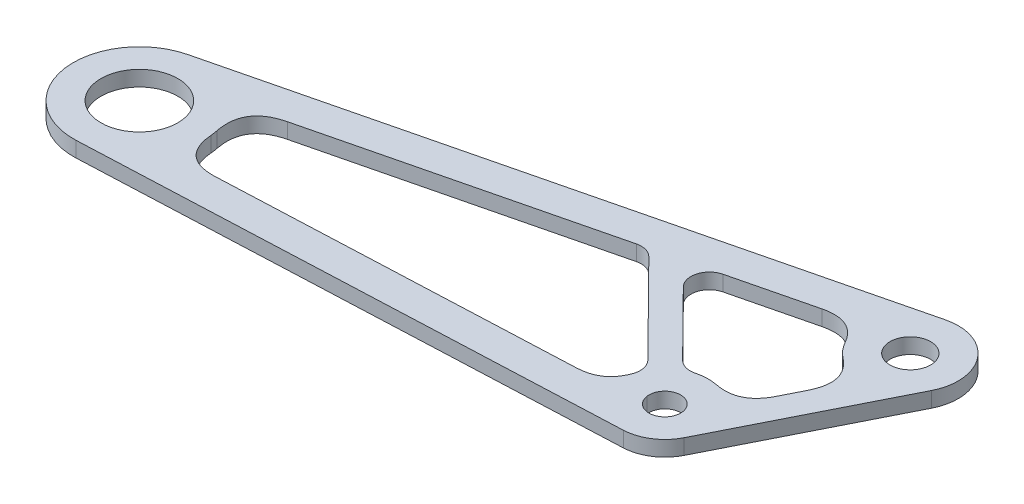
from build123d import *

# Parameters (mm, degrees)
BOSS_EXTRUDE4_DEPTH = 3.175
FILLET2_R           = 3.81


with BuildPart() as part:
    # Sketch1 → Boss-Extrude4 (new body)
    with BuildSketch(Plane(origin=(0, 0, 0), x_dir=(1, 0, 0), z_dir=(0, 1, 0))):
        with BuildLine():
            ThreePointArc((134.783763158, 34.440613651), (130.992755953, 42.233924829), (122.521356715, 44.06226552))
            ThreePointArc((122.521356715, 44.06226552), (117.722413764, 41.291147284), (115.162703171, 36.376187325))
            Line((115.162703171, 36.376187325), (123.88082197, 38.511312519))
            ThreePointArc((123.88082197, 38.511312519), (127.464875494, 37.737783765), (129.068763158, 34.440613651))
            ThreePointArc((129.068763158, 34.440613651), (128.955414212, 33.4725006), (128.621498601, 32.556754332))
            Line((128.621498601, 32.556754332), (124.58688197, 24.538885311))
            ThreePointArc((124.58688197, 24.538885311), (129.950478116, 25.932006306), (133.726592386, 29.98785526))
            ThreePointArc((133.726592386, 29.98785526), (134.515847468, 32.152346439), (134.783763158, 34.440613651))
        make_face()
        with BuildLine():
            Line((123.88082197, 38.511312519), (115.162703171, 36.376187325))
            ThreePointArc((115.162703171, 36.376187325), (115.052676855, 35.70414645), (114.98908268, 35.026134276))
            ThreePointArc((114.98908268, 35.026134276), (117.127915131, 28.270630543), (123.232258698, 24.672238604))
            ThreePointArc((123.232258698, 24.672238604), (123.907277135, 24.582267295), (124.58688197, 24.538885311))
            Line((124.58688197, 24.538885311), (128.621498601, 32.556754332))
            ThreePointArc((128.621498601, 32.556754332), (121.5989813, 31.830236182), (123.88082197, 38.511312519))
        make_face()
        with BuildLine():
            Line((122.521356715, 44.06226552), (-3.247611444, 13.260609947))
            ThreePointArc((-3.247611444, 13.260609947), (3.178857668, 13.277259513), (8.900967118, 10.351982448))
            Line((8.900967118, 10.351982448), (70.354618788, 25.402389875))
            Line((70.354618788, 25.402389875), (78.030840873, 27.282347644))
            Line((78.030840873, 27.282347644), (83.782484894, 28.690963463))
            Line((83.782484894, 28.690963463), (115.162703171, 36.376187325))
            ThreePointArc((115.162703171, 36.376187325), (117.722413764, 41.291147284), (122.521356715, 44.06226552))
        make_face()
        with BuildLine():
            ThreePointArc((8.900967118, 10.351982448), (3.178857668, 13.277259513), (-3.247611444, 13.260609947))
            ThreePointArc((-3.247611444, 13.260609947), (-13.515826194, -1.926966151), (0.587616374, -13.639848359))
            ThreePointArc((0.587616374, -13.639848359), (3.65523919, -13.15408616), (6.533692532, -11.987560976))
            ThreePointArc((6.533692532, -11.987560976), (9.268219921, -10.024512744), (11.439307143, -7.452047258))
            Line((11.439307143, -7.452047258), (0.341637427, -7.930144395))
            ThreePointArc((0.341637427, -7.930144395), (-7.858038485, -1.120329158), (-1.888146188, 7.709656946))
            Line((-1.888146188, 7.709656946), (8.900967118, 10.351982448))
        make_face()
        with BuildLine():
            ThreePointArc((9.985636063, 9.310092839), (9.457659775, 9.845985366), (8.900967118, 10.351982448))
            Line((8.900967118, 10.351982448), (-1.888146188, 7.709656946))
            ThreePointArc((-1.888146188, 7.709656946), (4.899833971, 6.244640367), (7.9375, 0))
            ThreePointArc((7.9375, 0), (5.732174689, -5.490544562), (0.341637427, -7.930144395))
            Line((0.341637427, -7.930144395), (11.439307143, -7.452047258))
            ThreePointArc((11.439307143, -7.452047258), (11.832412595, -6.810636419), (12.189591197, -6.148546389))
            ThreePointArc((12.189591197, -6.148546389), (13.281738404, -3.160091963), (13.6525, 0))
            ThreePointArc((13.6525, 0), (12.702748769, 5.003092039), (9.985636063, 9.310092839))
        make_face()
        with BuildLine():
            Line((70.354618788, 25.402389875), (8.900967118, 10.351982448))
            ThreePointArc((8.900967118, 10.351982448), (9.457659775, 9.845985366), (9.985636063, 9.310092839))
            Line((9.985636063, 9.310092839), (69.18664036, 23.808811963))
            Line((69.18664036, 23.808811963), (70.354618788, 25.402389875))
        make_face()
        with BuildLine():
            ThreePointArc((12.189591197, -6.148546389), (11.832412595, -6.810636419), (11.439307143, -7.452047258))
            Line((11.439307143, -7.452047258), (47.410466333, -5.902378846))
            Line((47.410466333, -5.902378846), (48.372525925, -4.589754505))
            Line((48.372525925, -4.589754505), (12.189591197, -6.148546389))
        make_face()
        with BuildLine():
            ThreePointArc((6.533692532, -11.987560976), (3.65523919, -13.15408616), (0.587616374, -13.639848359))
            Line((0.587616374, -13.639848359), (108.971460257, -8.970579339))
            ThreePointArc((108.971460257, -8.970579339), (108.77827491, -8.976819594), (108.585, -8.9789))
            ThreePointArc((108.585, -8.9789), (103.680463266, -7.521048108), (100.368568874, -3.620898335))
            Line((100.368568874, -3.620898335), (53.914169694, -5.622193724))
            Line((53.914169694, -5.622193724), (47.410466333, -5.902378846))
            Line((47.410466333, -5.902378846), (11.439307143, -7.452047258))
            ThreePointArc((11.439307143, -7.452047258), (9.268219921, -10.024512744), (6.533692532, -11.987560976))
        make_face()
        with BuildLine():
            Line((53.914169694, -5.622193724), (100.368568874, -3.620898335))
            ThreePointArc((100.368568874, -3.620898335), (100.12320514, -3.003110548), (99.924218758, -2.368863331))
            Line((99.924218758, -2.368863331), (54.876229285, -4.309569382))
            Line((54.876229285, -4.309569382), (53.914169694, -5.622193724))
        make_face()
        Polygon((48.372525925, -4.589754505), (47.410466333, -5.902378846), (53.914169694, -5.622193724), (54.876229285, -4.309569382), align=None)
        with BuildLine():
            Line((104.335087932, 7.90941797), (84.823475635, 27.638376771))
            Line((84.823475635, 27.638376771), (79.071831614, 26.229760952))
            Line((79.071831614, 26.229760952), (100.723144875, 4.337266328))
            ThreePointArc((100.723144875, 4.337266328), (102.271221973, 6.384109354), (104.335087932, 7.90941797))
        make_face()
        Polygon((78.030840873, 27.282347644), (70.354618788, 25.402389875), (69.18664036, 23.808811963), (76.862862445, 25.688769732), align=None)
        Polygon((84.823475635, 27.638376771), (83.782484894, 28.690963463), (78.030840873, 27.282347644), (79.071831614, 26.229760952), align=None)
        with BuildLine():
            ThreePointArc((114.98908268, 35.026134276), (115.052676855, 35.70414645), (115.162703171, 36.376187325))
            Line((115.162703171, 36.376187325), (83.782484894, 28.690963463))
            Line((83.782484894, 28.690963463), (84.823475635, 27.638376771))
            Line((84.823475635, 27.638376771), (114.98908268, 35.026134276))
        make_face()
        Polygon((79.071831614, 26.229760952), (78.030840873, 27.282347644), (76.862862445, 25.688769732), align=None)
        with BuildLine():
            Line((116.60566957, -4.036025875), (133.726592386, 29.98785526))
            ThreePointArc((133.726592386, 29.98785526), (129.950478116, 25.932006306), (124.58688197, 24.538885311))
            Line((124.58688197, 24.538885311), (115.260501822, 6.004858086))
            ThreePointArc((115.260501822, 6.004858086), (116.968296145, 3.21574112), (117.5639, 0))
            ThreePointArc((117.5639, 0), (117.321058471, -2.07410887), (116.60566957, -4.036025875))
        make_face()
        with BuildLine():
            ThreePointArc((108.585, -8.9789), (108.77827491, -8.976819594), (108.971460257, -8.970579339))
            ThreePointArc((108.971460257, -8.970579339), (113.459157615, -7.540771363), (116.60566957, -4.036025875))
            ThreePointArc((116.60566957, -4.036025875), (117.321058471, -2.07410887), (117.5639, 0))
            ThreePointArc((117.5639, 0), (116.968296145, 3.21574112), (115.260501822, 6.004858086))
            Line((115.260501822, 6.004858086), (111.500575784, -1.467126803))
            ThreePointArc((111.500575784, -1.467126803), (110.356794211, -2.741129053), (108.72548131, -3.260875375))
            Line((108.72548131, -3.260875375), (100.368568874, -3.620898335))
            ThreePointArc((100.368568874, -3.620898335), (103.680463266, -7.521048108), (108.585, -8.9789))
        make_face()
        with BuildLine():
            ThreePointArc((99.924218758, -2.368863331), (100.12320514, -3.003110548), (100.368568874, -3.620898335))
            Line((100.368568874, -3.620898335), (108.72548131, -3.260875375))
            ThreePointArc((108.72548131, -3.260875375), (106.227929768, 2.257711924), (111.8489, 0))
            ThreePointArc((111.8489, 0), (111.760625215, -0.75395471), (111.500575784, -1.467126803))
            Line((111.500575784, -1.467126803), (115.260501822, 6.004858086))
            ThreePointArc((115.260501822, 6.004858086), (114.79795902, 6.482266998), (114.301364272, 6.924147942))
            ThreePointArc((114.301364272, 6.924147942), (109.468351444, 8.935341932), (104.335087932, 7.90941797))
            ThreePointArc((104.335087932, 7.90941797), (102.271221973, 6.384109354), (100.723144875, 4.337266328))
            ThreePointArc((100.723144875, 4.337266328), (99.66914772, 1.062178575), (99.924218758, -2.368863331))
        make_face()
    extrude(amount=-BOSS_EXTRUDE4_DEPTH)

    # Fillet1
    # a fillet whose section is not a circle: 7.62 mm, written as the material it adds along each edge
    with BuildSketch(Plane(origin=(115.260501822, 0, -6.004858086), x_dir=(-0.8680919950979774, 0, -0.49640335217120884), z_dir=(0, -1, 0))) as fillet1_piece_1:
        with BuildLine():
            Bezier((5.628236023, 0), (0.097286133, 1.825453133), (0.407253439, 7.641603586), weights=[1, 1, 1])
            Line((0.407253439, 7.641603586), (0, 0))
            ThreePointArc((0, 0), (2.814118011, 0.452389282), (5.628236023, 0))
        make_face()
    extrude(amount=3.175)
    with BuildSketch(Plane(origin=(124.58688197, 0, -24.538885311), x_dir=(-0.940652377409321, 0, -0.3393716323946247), z_dir=(0, -1, 0))) as fillet1_piece_2:
        with BuildLine():
            Bezier((6.173495259, 0), (0.234745196, -1.947499202), (0.982676409, -8.152505596), weights=[1, 1, 1])
            Line((0.982676409, -8.152505596), (0, 0))
            ThreePointArc((0, 0), (3.08674763, -0.493198872), (6.173495259, 0))
        make_face()
    extrude(amount=3.175)
    with BuildSketch(Plane(origin=(114.98908268, 0, -35.026134276), x_dir=(0.22431195725050157, 0, 0.9745173912426853), z_dir=(0, -1, 0))) as fillet1_piece_3:
        with BuildLine():
            Bezier((5.577498608, 0), (0.022723171, 1.629700449), (0.103430981, 7.418045632), weights=[1, 1, 1])
            Line((0.103430981, 7.418045632), (0, 0))
            ThreePointArc((0, 0), (2.788749304, 0.400648175), (5.577498608, 0))
        make_face()
    extrude(amount=3.175)
    with BuildSketch(Plane(origin=(9.985636063, 0, -9.310092839), x_dir=(0.9712953632492297, 0, -0.23787668513443458), z_dir=(0, -1, 0))) as fillet1_piece_4:
        with BuildLine():
            Bezier((9.337508644, 0), (2.051395042, 0), (1.725151149, 7.27880597), weights=[1, 1, 1])
            ThreePointArc((1.725151149, 7.27880597), (1.370821683, 3.518943481), (0, 0))
            Line((0, 0), (9.337508644, 0))
        make_face()
    extrude(amount=3.175)
    with BuildSketch(Plane(origin=(99.924218758, 0, 2.368863331), x_dir=(-0.9990733095506228, 0, 0.04304093567251452), z_dir=(0, -1, 0))) as fillet1_piece_5:
        with BuildLine():
            Bezier((6.861639494, 0), (1.507461334, 0), (-0.307306015, 5.037245601), weights=[1, 1, 1])
            ThreePointArc((-0.307306015, 5.037245601), (0.207524079, 2.540657043), (0, 0))
            Line((0, 0), (6.861639494, 0))
        make_face()
    extrude(amount=3.175)
    with BuildSketch(Plane(origin=(12.189591197, 0, 6.148546389), x_dir=(0.18852682154069017, 0, -0.9820680412068018), z_dir=(0, -1, 0))) as fillet1_piece_6:
        with BuildLine():
            Bezier((7.480452048, 0), (0.473095274, 1.996096811), (2.153427849, 9.085803001), weights=[1, 1, 1])
            Line((2.153427849, 9.085803001), (0, 0))
            ThreePointArc((0, 0), (3.740226024, 0.522326142), (7.480452048, 0))
        make_face()
    extrude(amount=3.175)

    # Fillet2
    fillet2_edges = [part.edges().sort_by_distance(p)[0] for p in [
        (104.335087932, -1.5875, -7.90941797),
        (100.723144875, -1.5875, -4.337266328),
        (84.823475635, -1.5875, -27.638376771),
        (79.071831614, -1.5875, -26.229760952),
    ]]
    fillet(fillet2_edges, radius=FILLET2_R)


solid = part.part
